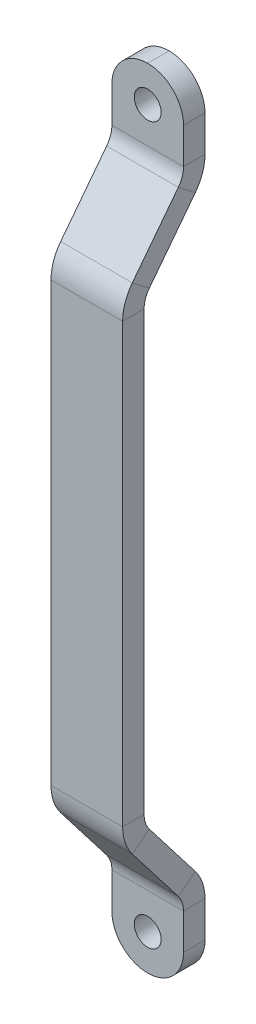
from build123d import *

# Parameters (mm, degrees)
SKETCH6_W          = 10
SKETCH6_H          = 3
SKETCH8_R          = 1.875
CUT_EXTRUDE2_DEPTH = 112.050664113
FILLET1_R          = 5


with BuildPart() as part:
    # Sweep1: sweep along a path in Sketch7
    with BuildLine(Plane(origin=(0, 0, 0), x_dir=(0, 0, -1), z_dir=(1, 0, 0))) as sweep1_path:
        Line((-1.5, 0), (-1.5, 10))
        ThreePointArc((-1.5, 10), (-1.766933397, 11.611856238), (-2.539232213, 13.051609172))
        Line((-2.539232213, 13.051609172), (-8.960767787, 21.386297467))
        ThreePointArc((-8.960767787, 21.386297467), (-9.733066603, 22.8260504), (-10, 24.437906639))
        Line((-10, 24.437906639), (-10, 55))
    # Sketch6 → Sweep1 (sweep)
    with BuildSketch(Plane(origin=(0, 0, 0), x_dir=(1, 0, 0), z_dir=(0, 1, 0))):
        with Locations((5, -1.5)):
            Rectangle(SKETCH6_W, SKETCH6_H)
    sweep(path=sweep1_path.line)

    # Mirror2: part across plane


with BuildPart() as part_1:
    add(part.part)
    add(part.part.mirror(Plane(origin=(0, 55, 8.5), x_dir=(0, 0, 1), z_dir=(0, 1, 0))))

    # Sketch8 → Cut-Extrude2 (cut, through all)
    with BuildSketch(Plane(origin=(0, 0, 0), x_dir=(-1, 0, 0), z_dir=(0, 0, -1))):
        with Locations((-5, 5)):
            Circle(SKETCH8_R)
        with Locations((-5, 105)):
            Circle(SKETCH8_R)
    extrude(amount=-CUT_EXTRUDE2_DEPTH, mode=Mode.SUBTRACT)

    # Fillet1
    fillet1_edges = [part_1.edges().sort_by_distance(p)[0] for p in [
        (0, 0, 1.5),
        (10, 0, 1.5),
        (10, 110, 1.5),
        (0, 110, 1.5),
    ]]
    fillet(fillet1_edges, radius=FILLET1_R - 0.0001)  # a hair under: the kernel refuses the full size


solid = part_1.part
